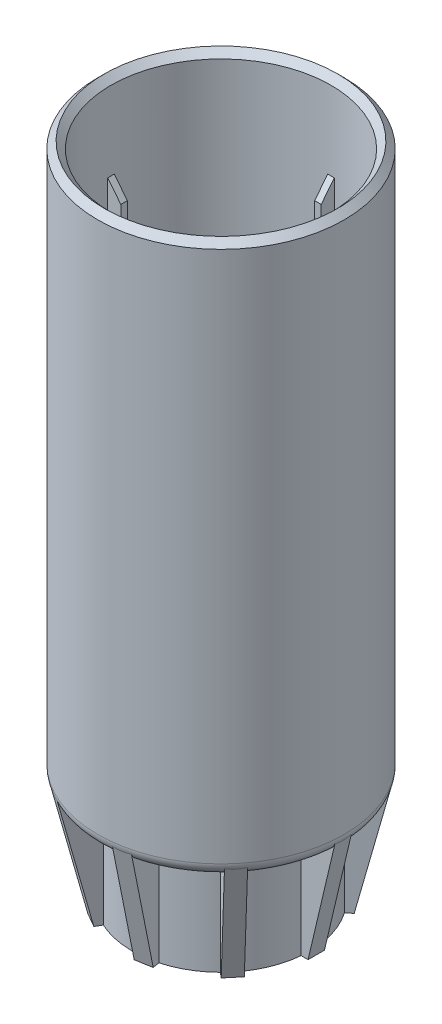
from build123d import *

# Parameters (mm, degrees)
SKETCH1_R          = 18.75
SKETCH1_R_2        = 16.75
EXTRUDE1_DEPTH     = 84
SKETCH2_R          = 16.75
EXTRUDE2_DEPTH     = 2
SKETCH3_R          = 6
CUT_EXTRUDE1_DEPTH = 89.085895579
SKETCH4_R          = 8
SKETCH4_R_2        = 6
EXTRUDE3_DEPTH     = 1
FILLET1_R          = 3
FILLET2_R          = 2
SKETCH5_R          = 13.5
SKETCH5_R_2        = 10.5
EXTRUDE4_DEPTH     = 16
RIB4_START         = -1.25
RIB4_DEPTH         = 2.5
CIRPATTERN1_COUNT  = 9
RIB6_START         = -0.5
RIB6_DEPTH         = 1
CIRPATTERN2_COUNT  = 4
CHAMFER1_SIZE      = 1


with BuildPart() as part:
    # Sketch1 → Extrude1 (new body)
    with BuildSketch(Plane(origin=(0, 0, 0), x_dir=(1, 0, 0), z_dir=(0, 1, 0))):
        with Locations(Location((0, 0, 0), (0, 0, 90))):
            Circle(SKETCH1_R)
        with Locations(Location((0, 0, 0), (0, 0, 90))):
            Circle(SKETCH1_R_2, mode=Mode.SUBTRACT)
    extrude(amount=EXTRUDE1_DEPTH)

    # Sketch2 → Extrude2 (add)
    with BuildSketch(Plane.XZ):
        with Locations(Location((0, 0, 0), (0, 0, 270))):
            Circle(SKETCH2_R)
    extrude(amount=-EXTRUDE2_DEPTH)

    # Sketch3 → Cut-Extrude1 (cut, through all)
    with BuildSketch(Plane.XZ):
        with Locations(Location((0, 0, 0), (0, 0, 270))):
            Circle(SKETCH3_R)
    extrude(amount=-CUT_EXTRUDE1_DEPTH, mode=Mode.SUBTRACT)

    # Sketch4 → Extrude3 (add)
    with BuildSketch(Plane(origin=(0, 2, 0), x_dir=(-1, 0, 0), z_dir=(0, 1, 0))):
        with Locations(Location((0, 0, 0), (0, 0, 270))):
            Circle(SKETCH4_R)
        with Locations(Location((0, 0, 0), (0, 0, 270))):
            Circle(SKETCH4_R_2, mode=Mode.SUBTRACT)
    extrude(amount=EXTRUDE3_DEPTH)

    # Fillet1
    fillet1_edges = [part.edges().sort_by_distance(p)[0] for p in [
        (0, 2, 16.75),
    ]]
    fillet(fillet1_edges, radius=FILLET1_R)

    # Fillet2
    fillet2_edges = [part.edges().sort_by_distance(p)[0] for p in [
        (0, 0, 18.75),
    ]]
    fillet(fillet2_edges, radius=FILLET2_R)

    # Sketch5 → Extrude4 (add)
    with BuildSketch(Plane.XZ):
        with Locations(Location((0, 0, 0), (0, 0, 90))):
            Circle(SKETCH5_R)
        with Locations(Location((0, 0, 0), (0, 0, 270))):
            Circle(SKETCH5_R_2, mode=Mode.SUBTRACT)
    extrude(amount=EXTRUDE4_DEPTH)


with BuildPart() as rib4_tool:
    # Rib4: read off the stored shape, not the designer's step
    # Rib4 outline → Rib4 (new body)
    with BuildSketch(Plane.XY.offset(RIB4_START)):
        with BuildLine():
            Line((13.442005059, -16), (14.5, -16))
            Line((14.5, -16), (18.590526062, 1.32459857))
            add(Edge.make_bspline(
                [(18.590526062, 1.32459857), (18.568608112, 1.263648671), (18.543728037, 1.20376382), (18.467946423, 1.043822719), (18.411333784, 0.9464728), (18.282533056, 0.762544276), (18.210329497, 0.675976506), (18.052439943, 0.516161522), (17.966753798, 0.442914457), (17.784150054, 0.311660282), (17.687210272, 0.253684034), (17.484990742, 0.154784456), (17.379710868, 0.113861381), (17.163528833, 0.050127852), (17.052613757, 0.027361202), (16.861851109, 0.004693007), (16.782571963, 5.598e-06), (16.703293088, 2.954e-06)],
                knots=[8.234213693, 8.234213693, 8.234213693, 8.234213693, 8.428296491, 8.428296491, 8.764546121, 8.764546121, 9.101130911, 9.101130911, 9.43771945, 9.43771945, 9.774983094, 9.774983094, 10.112251783, 10.112251783, 10.450331737, 10.450331737, 10.687887798, 10.687887798, 10.687887798, 10.687887798], degree=3))
            Line((16.703293088, 2.954e-06), (13.442005059, 0))
            Line((13.442005059, 0), (13.442005059, -16))
        make_face()
    rib4 = extrude(amount=RIB4_DEPTH)


with BuildPart() as part_1:
    add(part.part)


with BuildPart() as part_2:
    # Rib4: joined with rib4_tool
    add(part_1.part.fuse(rib4_tool.part, tol=0.00001))

    # CirPattern1: Rib4 ×9 about axis
    cirpattern1_axis = Axis((0, 0, 0), (0, 1, 0))
    for i in range(1, CIRPATTERN1_COUNT):
        add(rib4.rotate(cirpattern1_axis, i * 360 / CIRPATTERN1_COUNT))

    # Rib6: read off the stored shape, not the designer's step
    # Rib6 outline → Rib6 (add)
    with BuildSketch(Plane.XY.offset(RIB6_START)):
        Polygon((14.75, 68.544950946), (14.75, 3), (6, 3), (6, 2), (18, 2), (18, 72.607450946), align=None)
    rib6 = extrude(amount=RIB6_DEPTH)

    # CirPattern2: Rib6 ×4 about axis
    cirpattern2_axis = Axis((0, 0, 0), (0, 1, 0))
    for i in range(1, CIRPATTERN2_COUNT):
        add(rib6.rotate(cirpattern2_axis, i * 360 / CIRPATTERN2_COUNT))

    # Chamfer1
    chamfer1_edges = [part_2.edges().sort_by_distance(p)[0] for p in [
        (0, 84, 18.75),
        (0, 84, 16.75),
    ]]
    chamfer(chamfer1_edges, length=CHAMFER1_SIZE - 0.0001)  # a hair under: the kernel refuses the full size


solid = part_2.part
